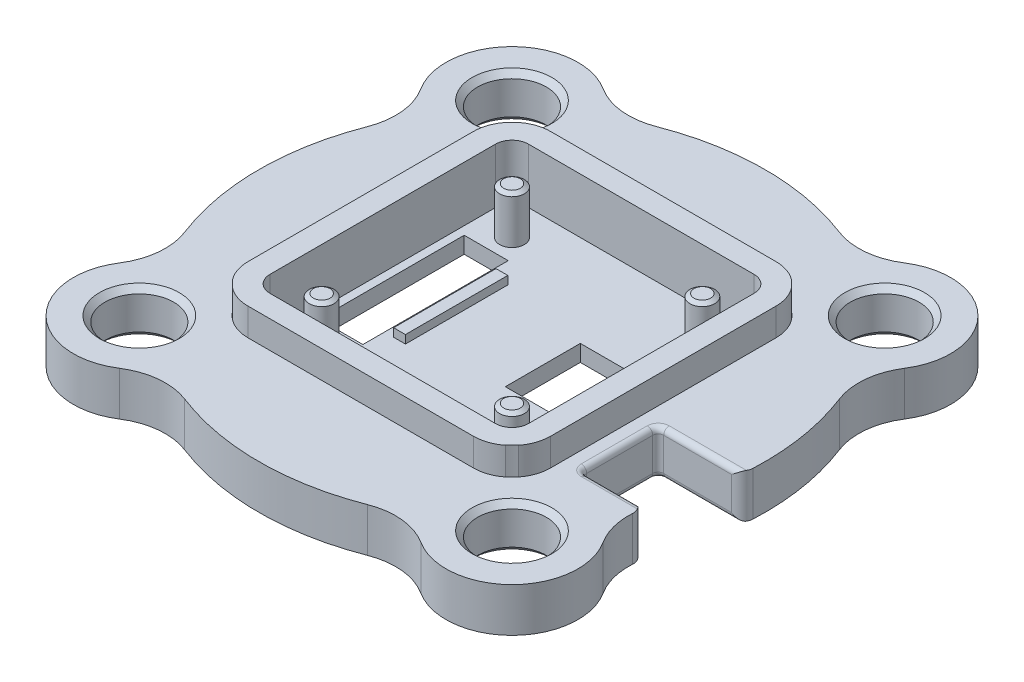
from build123d import *
from OCP.BRepFilletAPI import BRepFilletAPI_MakeChamfer

# Parameters (mm, degrees)
SKETCH1_W           = 4
SKETCH1_H           = 13.20710931
BOSS_EXTRUDE1_DEPTH = 1.5
BOSS_EXTRUDE7_START = 1.5
SKETCH1_10_W        = 1.073289239
SKETCH1_10_H        = 9.306047289
BOSS_EXTRUDE7_DEPTH = 0.75
BOSS_EXTRUDE4_DEPTH = 6.5
SKETCH1_7_R         = 3.125
BOSS_EXTRUDE5_DEPTH = 4
SKETCH1_8_R         = 1.125
BOSS_EXTRUDE6_DEPTH = 5.75
CHAMFER1_SIZE       = 0.25
CHAMFER1_SIZE2      = 0.370640242
CHAMFER2_SIZE       = 0.5
FILLET1_R           = 6
SKETCH2_W           = 13.595412958
SKETCH2_H           = 7
CUT_EXTRUDE1_DEPTH  = 10
FILLET2_R           = 0.5
FILLET3_START       = -1
FILLET3_DEPTH       = 6


with BuildPart() as part:
    # Sketch1 → Boss-Extrude1 (new body)
    with BuildSketch(Plane(origin=(0, 0, 0), x_dir=(1, 0, 0), z_dir=(0, 1, 0))):
        with BuildLine():
            Line((10.25, 11.75), (-10.25, 11.75))
            ThreePointArc((-10.25, 11.75), (-11.310660172, 11.310660172), (-11.75, 10.25))
            Line((-11.75, 10.25), (-11.75, -10.25))
            ThreePointArc((-11.75, -10.25), (-11.310660172, -11.310660172), (-10.25, -11.75))
            Line((-10.25, -11.75), (10.25, -11.75))
            ThreePointArc((10.25, -11.75), (11.310660172, -11.310660172), (11.75, -10.25))
            Line((11.75, -10.25), (11.75, 10.25))
            ThreePointArc((11.75, 10.25), (11.310660172, 11.310660172), (10.25, 11.75))
        make_face()
        with Locations((-9, 0.048761158)):
            Rectangle(SKETCH1_W, SKETCH1_H, mode=Mode.SUBTRACT)
        Polygon((11, -6.554793497), (7, -6.554793497), (7, -3.401386803), (2.793672018, -3.401386803), (2.793672018, 3.417114723), (7, 3.417114723), (7, 6.652315813), (11, 6.652315813), align=None, mode=Mode.SUBTRACT)
    extrude(amount=BOSS_EXTRUDE1_DEPTH)

    # Sketch1<10> → Boss-Extrude7 (add)
    with BuildSketch(Plane(origin=(0, 0, 0), x_dir=(1, 0, 0), z_dir=(0, 1, 0)).offset(BOSS_EXTRUDE7_START)):
        with Locations((-5.639254257, 0.06795853)):
            Rectangle(SKETCH1_10_W, SKETCH1_10_H)
    extrude(amount=BOSS_EXTRUDE7_DEPTH)

    # Sketch1<6> → Boss-Extrude4 (add)
    with BuildSketch(Plane(origin=(0, 0, 0), x_dir=(1, 0, 0), z_dir=(0, 1, 0))):
        with BuildLine():
            Line((10.25, 13.75), (-10.25, 13.75))
            ThreePointArc((-10.25, 13.75), (-11.386617955, 13.560302044), (-12.400027852, 13.011771214))
            ThreePointArc((-12.400027852, 13.011771214), (-12.694859313, 12.694859313), (-13.011771214, 12.400027852))
            ThreePointArc((-13.011771214, 12.400027852), (-13.560302044, 11.386617955), (-13.75, 10.25))
            Line((-13.75, 10.25), (-13.75, -10.25))
            ThreePointArc((-13.75, -10.25), (-13.560302044, -11.386617955), (-13.011771214, -12.400027852))
            ThreePointArc((-13.011771214, -12.400027852), (-12.694859313, -12.694859313), (-12.400027852, -13.011771214))
            ThreePointArc((-12.400027852, -13.011771214), (-11.386617955, -13.560302044), (-10.25, -13.75))
            Line((-10.25, -13.75), (10.25, -13.75))
            ThreePointArc((10.25, -13.75), (11.386617955, -13.560302044), (12.400027852, -13.011771214))
            ThreePointArc((12.400027852, -13.011771214), (12.694859313, -12.694859313), (13.011771214, -12.400027852))
            ThreePointArc((13.011771214, -12.400027852), (13.560302044, -11.386617955), (13.75, -10.25))
            Line((13.75, -10.25), (13.75, 10.25))
            ThreePointArc((13.75, 10.25), (13.560302044, 11.386617955), (13.011771214, 12.400027852))
            ThreePointArc((13.011771214, 12.400027852), (12.694859313, 12.694859313), (12.400027852, 13.011771214))
            ThreePointArc((12.400027852, 13.011771214), (11.386617955, 13.560302044), (10.25, 13.75))
        make_face()
        with BuildLine():
            ThreePointArc((-11.75, 10.25), (-11.310660172, 11.310660172), (-10.25, 11.75))
            Line((-10.25, 11.75), (10.25, 11.75))
            ThreePointArc((10.25, 11.75), (11.310660172, 11.310660172), (11.75, 10.25))
            Line((11.75, 10.25), (11.75, -10.25))
            ThreePointArc((11.75, -10.25), (11.310660172, -11.310660172), (10.25, -11.75))
            Line((10.25, -11.75), (-10.25, -11.75))
            ThreePointArc((-10.25, -11.75), (-11.310660172, -11.310660172), (-11.75, -10.25))
            Line((-11.75, -10.25), (-11.75, 10.25))
        make_face(mode=Mode.SUBTRACT)
    extrude(amount=BOSS_EXTRUDE4_DEPTH)

    # Sketch1<7> → Boss-Extrude5 (add)
    with BuildSketch(Plane(origin=(0, 0, 0), x_dir=(1, 0, 0), z_dir=(0, 1, 0))):
        with BuildLine():
            ThreePointArc((19.817252096, -11.673753439), (23, 0), (19.817252096, 11.673753439))
            ThreePointArc((19.817252096, 11.673753439), (21.180140687, 21.180140687), (11.673753439, 19.817252096))
            ThreePointArc((11.673753439, 19.817252096), (0, 23), (-11.673753439, 19.817252096))
            ThreePointArc((-11.673753439, 19.817252096), (-21.180140687, 21.180140687), (-19.817252096, 11.673753439))
            ThreePointArc((-19.817252096, 11.673753439), (-23, 0), (-19.817252096, -11.673753439))
            ThreePointArc((-19.817252096, -11.673753439), (-21.180140687, -21.180140687), (-11.673753439, -19.817252096))
            ThreePointArc((-11.673753439, -19.817252096), (0, -23), (11.673753439, -19.817252096))
            ThreePointArc((11.673753439, -19.817252096), (21.180140687, -21.180140687), (19.817252096, -11.673753439))
        make_face()
        with BuildLine():
            Line((-10.25, 13.75), (10.25, 13.75))
            ThreePointArc((10.25, 13.75), (12.724873734, 12.724873734), (13.75, 10.25))
            Line((13.75, 10.25), (13.75, -10.25))
            ThreePointArc((13.75, -10.25), (12.724873734, -12.724873734), (10.25, -13.75))
            Line((10.25, -13.75), (-10.25, -13.75))
            ThreePointArc((-10.25, -13.75), (-12.724873734, -12.724873734), (-13.75, -10.25))
            Line((-13.75, -10.25), (-13.75, 10.25))
            ThreePointArc((-13.75, 10.25), (-12.724873734, 12.724873734), (-10.25, 13.75))
        make_face(mode=Mode.SUBTRACT)
        with Locations(Location((-16.9375, -16.9375, 0), (0, 0, 270))):
            Circle(SKETCH1_7_R, mode=Mode.SUBTRACT)
        with Locations(Location((-16.9375, 16.9375, 0), (0, 0, 270))):
            Circle(SKETCH1_7_R, mode=Mode.SUBTRACT)
        with Locations(Location((16.9375, 16.9375, 0), (0, 0, 270))):
            Circle(SKETCH1_7_R, mode=Mode.SUBTRACT)
        with Locations(Location((16.9375, -16.9375, 0), (0, 0, 270))):
            Circle(SKETCH1_7_R, mode=Mode.SUBTRACT)
    extrude(amount=BOSS_EXTRUDE5_DEPTH)

    # Sketch1<8> → Boss-Extrude6 (add)
    with BuildSketch(Plane(origin=(0, 0, 0), x_dir=(1, 0, 0), z_dir=(0, 1, 0))):
        with Locations(Location((-8.65, 8.65, 0), (0, 0, 270))):
            Circle(SKETCH1_8_R)
        with Locations(Location((8.65, 8.65, 0), (0, 0, 270))):
            Circle(SKETCH1_8_R)
        with Locations(Location((-8.65, -8.65, 0), (0, 0, 270))):
            Circle(SKETCH1_8_R)
        with Locations(Location((8.65, -8.65, 0), (0, 0, 270))):
            Circle(SKETCH1_8_R)
    extrude(amount=BOSS_EXTRUDE6_DEPTH)

    # Chamfer1: one chamfer whose edges measure the first distance from different faces: ONE call of the kernel's chamfer builder (chamfer() names one face for all edges)
    chamfer1_edges_1 = [part.edges().sort_by_distance(p)[0] for p in [
        (-8.65, 5.75, -9.775),
    ]]
    chamfer1_side_1 = [part.faces().sort_by_distance(p)[0] for p in [
        (-8.65, 3.625, -9.775),
    ]]
    chamfer1_edges_2 = [part.edges().sort_by_distance(p)[0] for p in [
        (8.65, 5.75, -9.775),
    ]]
    chamfer1_side_2 = [part.faces().sort_by_distance(p)[0] for p in [
        (8.65, 3.625, -9.775),
    ]]
    chamfer1_edges_3 = [part.edges().sort_by_distance(p)[0] for p in [
        (8.65, 5.75, 7.525),
    ]]
    chamfer1_side_3 = [part.faces().sort_by_distance(p)[0] for p in [
        (8.65, 3.625, 7.525),
    ]]
    chamfer1_edges_4 = [part.edges().sort_by_distance(p)[0] for p in [
        (-8.65, 5.75, 7.525),
    ]]
    chamfer1_side_4 = [part.faces().sort_by_distance(p)[0] for p in [
        (-8.65, 3.625, 7.525),
    ]]
    chamfer1 = BRepFilletAPI_MakeChamfer(part.part.solid().wrapped)
    for e in chamfer1_edges_1:
        chamfer1.Add(CHAMFER1_SIZE, CHAMFER1_SIZE2, e.wrapped, chamfer1_side_1[0].wrapped)  # the first distance lies on this face
    for e in chamfer1_edges_2:
        chamfer1.Add(CHAMFER1_SIZE, CHAMFER1_SIZE2, e.wrapped, chamfer1_side_2[0].wrapped)  # the first distance lies on this face
    for e in chamfer1_edges_3:
        chamfer1.Add(CHAMFER1_SIZE, CHAMFER1_SIZE2, e.wrapped, chamfer1_side_3[0].wrapped)  # the first distance lies on this face
    for e in chamfer1_edges_4:
        chamfer1.Add(CHAMFER1_SIZE, CHAMFER1_SIZE2, e.wrapped, chamfer1_side_4[0].wrapped)  # the first distance lies on this face
    add(Compound.cast(chamfer1.Shape()), mode=Mode.REPLACE)

    # Chamfer2
    chamfer2_edges = [part.edges().sort_by_distance(p)[0] for p in [
        (16.9375, 4, 13.8125),
        (-16.9375, 0, 13.8125),
        (16.9375, 0, -20.0625),
        (-16.9375, 4, -20.0625),
        (16.9375, 4, -20.0625),
        (-16.9375, 4, 13.8125),
        (-16.9375, 0, -20.0625),
        (16.9375, 0, 13.8125),
    ]]
    chamfer(chamfer2_edges, length=CHAMFER2_SIZE)

    # Fillet1
    fillet1_edges = [part.edges().sort_by_distance(p)[0] for p in [
        (11.673753439, 2, -19.817252096),
        (-11.673753439, 2, -19.817252096),
        (-19.817252096, 2, -11.673753439),
        (-19.817252096, 2, 11.673753439),
        (-11.673753439, 2, 19.817252096),
        (11.673753439, 2, 19.817252096),
        (19.817252096, 2, 11.673753439),
        (19.817252096, 2, -11.673753439),
    ]]
    fillet(fillet1_edges, radius=FILLET1_R)

    # Sketch2 → Cut-Extrude1 (cut)
    with BuildSketch(Plane(origin=(0, 4, 0), x_dir=(1, 0, 0), z_dir=(0, 1, 0))):
        with Locations((22.11761689, -5.52795482)):
            Rectangle(SKETCH2_W, SKETCH2_H)
    extrude(amount=-CUT_EXTRUDE1_DEPTH, mode=Mode.SUBTRACT)

    # Fillet2
    fillet2_edges = [part.edges().sort_by_distance(p)[0] for p in [
        (15.319910411, 0, 5.52795482),
        (15.319910411, 2, 9.02795482),
        (19.115165802, 0, 2.02795482),
        (15.319910411, 2, 2.02795482),
        (18.270000077, 0, 9.02795482),
        (19.115165802, 4, 2.02795482),
        (15.319910411, 4, 5.52795482),
        (18.270000077, 4, 9.02795482),
    ]]
    fillet(fillet2_edges, radius=FILLET2_R)

    # Fillet3: read off the stored shape, not the designer's step
    # Fillet3 outline → Fillet3 (cut)
    with BuildSketch(Plane(origin=(0, 0, 0), x_dir=(1, 0, 0), z_dir=(0, 1, 0)).offset(FILLET3_START)):
        with BuildLine():
            ThreePointArc((22.910420735, -2.027959995), (22.947600473, -1.551654765), (22.974878951, -1.074680039))
            ThreePointArc((22.974878951, -1.074680039), (22.666360474, -1.751392868), (21.975971171, -2.02795482))
            Line((21.975971171, -2.02795482), (22.910420735, -2.027959995))
        make_face()
        with BuildLine():
            ThreePointArc((20.058455778, -9.02795482), (20.787477444, -9.343464199), (21.056472764, -10.090899999))
            ThreePointArc((21.056472764, -10.090899999), (21.114417887, -9.555751044), (21.220091225, -9.027948821))
            Line((21.220091225, -9.027948821), (20.058455778, -9.02795482))
        make_face()
    extrude(amount=FILLET3_DEPTH, mode=Mode.SUBTRACT)


solid = part.part
